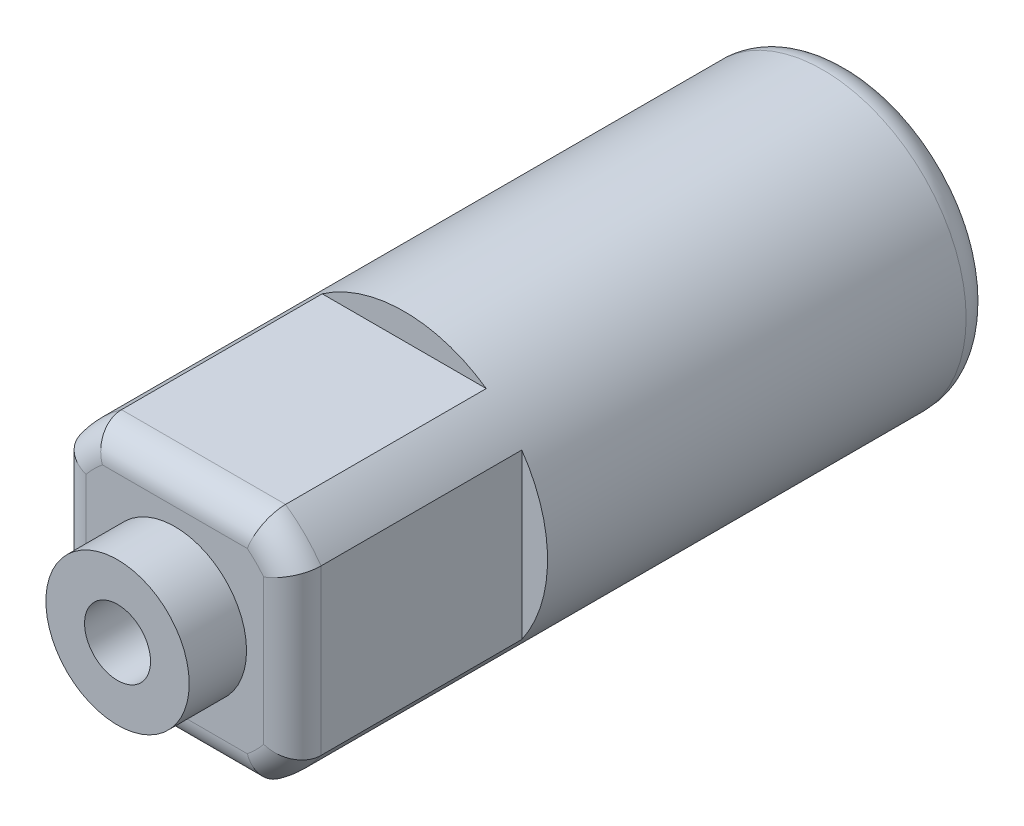
from build123d import *

# Parameters (mm, degrees)
SKICA1_R                 = 5
P_IDAT_VYSUNUT_M1_DEPTH  = 23.6
SKICA2_OUTSIDE_W         = 17.502
SKICA2_OUTSIDE_H         = 17.502
SKICA2_OUTSIDE_W_2       = 8.2
SKICA2_OUTSIDE_H_2       = 8.2
ODEBRAT_VYSUNUT_M1_DEPTH = 8
SKICA3_R                 = 2.5
P_IDAT_VYSUNUT_M2_DEPTH  = 2
SKICA4_R                 = 1.15
ODEBRAT_VYSUNUT_M2_DEPTH = 11
ZAOBLIT1_R               = 1


with BuildPart() as part:
    # Skica1 → Přidat vysunutím1 (new body)
    with BuildSketch(Plane.XY):
        Circle(SKICA1_R)
    extrude(amount=P_IDAT_VYSUNUT_M1_DEPTH)

    # Skica2 outside → Odebrat vysunutím1 (cut)
    with BuildSketch(Plane(origin=(0, 0, 23.6), x_dir=(-1, 0, 0), z_dir=(0, 0, -1))):
        Rectangle(SKICA2_OUTSIDE_W, SKICA2_OUTSIDE_H)
        Rectangle(SKICA2_OUTSIDE_W_2, SKICA2_OUTSIDE_H_2, mode=Mode.SUBTRACT)
    extrude(amount=ODEBRAT_VYSUNUT_M1_DEPTH, mode=Mode.SUBTRACT)

    # Skica3 → Přidat vysunutím2 (add)
    with BuildSketch(Plane.XY.offset(23.6)):
        Circle(SKICA3_R)
    extrude(amount=P_IDAT_VYSUNUT_M2_DEPTH)

    # Skica4 → Odebrat vysunutím2 (cut)
    with BuildSketch(Plane.XY.offset(25.6)):
        Circle(SKICA4_R)
    extrude(amount=-ODEBRAT_VYSUNUT_M2_DEPTH, mode=Mode.SUBTRACT)

    # Zaoblit1
    # the kernel refuses this fillet: 1 mm, written as the material it adds along each edge
    with BuildSketch(Plane(origin=(0, 0, 14.6), x_dir=(1, 0, 0), z_dir=(0, -1, 0))) as zaoblit1_piece_1:
        with BuildLine():
            CenterArc((1.15 - ZAOBLIT1_R, ZAOBLIT1_R), ZAOBLIT1_R, 270, 90)
            Line((1.15 - ZAOBLIT1_R, 0), (1.15, 0))
            Line((1.15, 0), (1.15, ZAOBLIT1_R))
        make_face()
    revolve(axis=Axis((0, 0, 14.6), (0, 0, 1)))
    # the kernel refuses this fillet: 1 mm, written as the material it takes off along each edge
    with BuildSketch(Plane(origin=(0, 0, 0), x_dir=(1, 0, 0), z_dir=(0, -1, 0))) as zaoblit1_2_piece_1:
        with BuildLine():
            CenterArc((5 - ZAOBLIT1_R, ZAOBLIT1_R), ZAOBLIT1_R, 270, 90)
            Line((5 - ZAOBLIT1_R, 0), (5, 0))
            Line((5, 0), (5, ZAOBLIT1_R))
        make_face()
    revolve(axis=Axis((0, 0, 0), (0, 0, 1)), mode=Mode.SUBTRACT)
    with BuildSketch(Plane(origin=(0, 0, 23.6), x_dir=(0.9940244909072117, 0.109157278624279, 0), z_dir=(0.109157278624279, -0.9940244909072117, 0))) as zaoblit1_2_piece_2:
        with BuildLine():
            CenterArc((5 - ZAOBLIT1_R, -ZAOBLIT1_R), ZAOBLIT1_R, 0, 90)
            Line((5 - ZAOBLIT1_R, 0), (5, 0))
            Line((5, 0), (5, -ZAOBLIT1_R))
        make_face()
    revolve(axis=Axis((0, 0, 23.6), (0, 0, 1)), revolution_arc=77.466522668, mode=Mode.SUBTRACT)
    with BuildSketch(Plane(origin=(0, 0, 23.6), x_dir=(-0.10915727862431812, 0.9940244909072075, 0), z_dir=(0.9940244909072075, 0.10915727862431812, 0))) as zaoblit1_2_piece_3:
        with BuildLine():
            CenterArc((5 - ZAOBLIT1_R, -ZAOBLIT1_R), ZAOBLIT1_R, 0, 90)
            Line((5 - ZAOBLIT1_R, 0), (5, 0))
            Line((5, 0), (5, -ZAOBLIT1_R))
        make_face()
    revolve(axis=Axis((0, 0, 23.6), (0, 0, 1)), revolution_arc=77.466522668, mode=Mode.SUBTRACT)
    with BuildSketch(Plane(origin=(0, 0, 23.6), x_dir=(-0.9940244909072075, -0.1091572786243185, 0), z_dir=(-0.1091572786243185, 0.9940244909072075, 0))) as zaoblit1_2_piece_4:
        with BuildLine():
            CenterArc((5 - ZAOBLIT1_R, -ZAOBLIT1_R), ZAOBLIT1_R, 0, 90)
            Line((5 - ZAOBLIT1_R, 0), (5, 0))
            Line((5, 0), (5, -ZAOBLIT1_R))
        make_face()
    revolve(axis=Axis((0, 0, 23.6), (0, 0, 1)), revolution_arc=77.466522668, mode=Mode.SUBTRACT)
    with BuildSketch(Plane(origin=(0, 0, 23.6), x_dir=(0.10915727862436878, -0.9940244909072019, 0), z_dir=(-0.9940244909072019, -0.10915727862436878, 0))) as zaoblit1_2_piece_5:
        with BuildLine():
            CenterArc((5 - ZAOBLIT1_R, -ZAOBLIT1_R), ZAOBLIT1_R, 0, 90)
            Line((5 - ZAOBLIT1_R, 0), (5, 0))
            Line((5, 0), (5, -ZAOBLIT1_R))
        make_face()
    revolve(axis=Axis((0, 0, 23.6), (0, 0, 1)), revolution_arc=77.466522668, mode=Mode.SUBTRACT)
    with BuildSketch(Plane(origin=(5.361817604, -4.1, 23.6), x_dir=(0, 1, 0), z_dir=(-1, 0, 0)), Plane(origin=(-5.361817604, 4.1, 23.6), x_dir=(0, -1, 0), z_dir=(1, 0, 0)), Plane(origin=(-4.1, -5.361817604, 23.6), x_dir=(1, 0, 0), z_dir=(0, 1, 0))) as zaoblit1_2_piece_6:
        with BuildLine():
            CenterArc((ZAOBLIT1_R, ZAOBLIT1_R), ZAOBLIT1_R, 180, 90)
            Line((0, ZAOBLIT1_R), (0, 0))
            Line((0, 0), (ZAOBLIT1_R, 0))
        make_face()
    extrude(amount=10.723635209, mode=Mode.SUBTRACT)
    with BuildSketch(Plane(origin=(4.1, 5.361817604, 23.6), x_dir=(0, 0, -1), z_dir=(0, -1, 0))) as zaoblit1_2_piece_7:
        with BuildLine():
            CenterArc((ZAOBLIT1_R, -ZAOBLIT1_R), ZAOBLIT1_R, 90, 90)
            Line((0, -ZAOBLIT1_R), (0, 0))
            Line((0, 0), (ZAOBLIT1_R, 0))
        make_face()
    extrude(amount=10.723635209, mode=Mode.SUBTRACT)


solid = part.part
